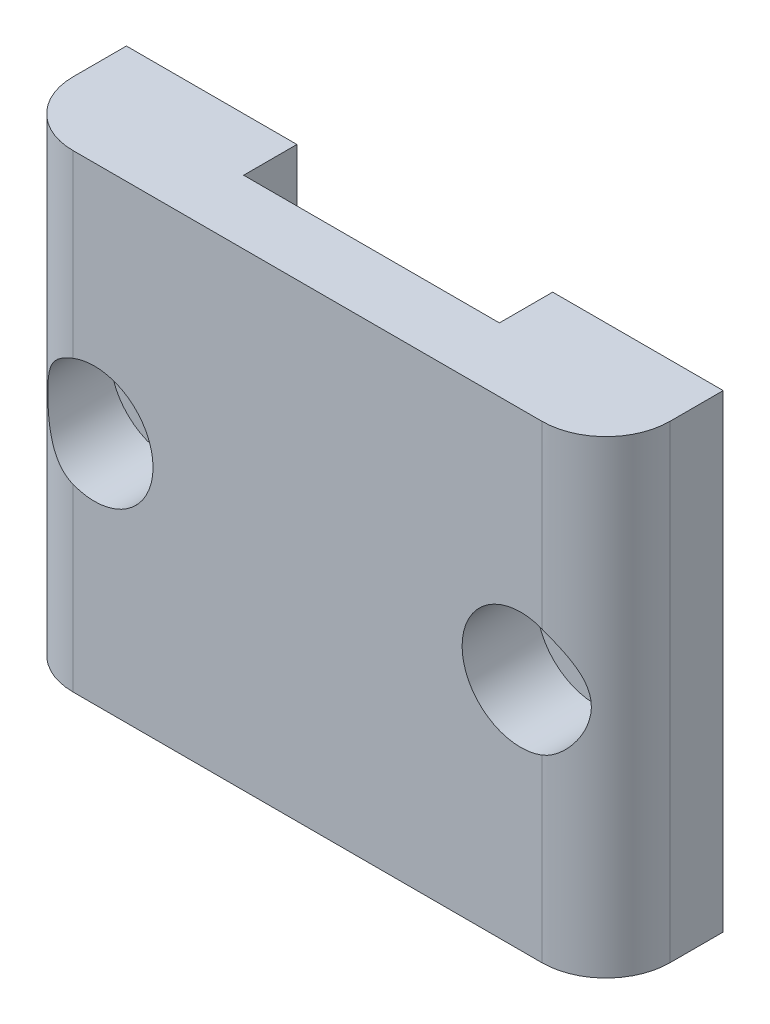
from build123d import *

# Parameters (mm, degrees)
SKETCH1_W           = 28
SKETCH1_H           = 22
BOSS_EXTRUDE1_DEPTH = 3
SKETCH2_W           = 8
SKETCH2_H           = 22
BOSS_EXTRUDE2_DEPTH = 2.5
SKETCH3_R           = 1.6
CUT_EXTRUDE1_DEPTH  = 19.634645154
SKETCH4_R           = 2.75
CUT_EXTRUDE2_DEPTH  = 3.5
FILLET1_R           = 3


with BuildPart() as part:
    # Sketch1 → Boss-Extrude1 (new body)
    with BuildSketch(Plane.XY):
        Rectangle(SKETCH1_W, SKETCH1_H)
    extrude(amount=-BOSS_EXTRUDE1_DEPTH)

    # Sketch2 → Boss-Extrude2 (add)
    with BuildSketch(Plane(origin=(0, 0, -3), x_dir=(-1, 0, 0), z_dir=(0, 0, -1))):
        with Locations((10, 0)):
            Rectangle(SKETCH2_W, SKETCH2_H)
        with Locations((-10, 0)):
            Rectangle(SKETCH2_W, SKETCH2_H)
    extrude(amount=BOSS_EXTRUDE2_DEPTH)

    # Sketch3 → Cut-Extrude1 (cut, through all)
    with BuildSketch(Plane(origin=(0, 0, -5.5), x_dir=(-1, 0, 0), z_dir=(0, 0, -1))):
        with Locations((-10, 0)):
            Circle(SKETCH3_R)
        with Locations(Location((10, 0, 0), (0, 0, 180))):
            Circle(SKETCH3_R)
    extrude(amount=-CUT_EXTRUDE1_DEPTH, mode=Mode.SUBTRACT)

    # Sketch4 → Cut-Extrude2 (cut)
    with BuildSketch(Plane.XY):
        with Locations((-10, 0)):
            Circle(SKETCH4_R)
        with Locations((10, 0)):
            Circle(SKETCH4_R)
    extrude(amount=-CUT_EXTRUDE2_DEPTH, mode=Mode.SUBTRACT)

    # Fillet1
    # the kernel refuses this fillet: 3 mm, written as the material it takes off along each edge
    with BuildSketch(Plane(origin=(14, 18.5, 0), x_dir=(0, 0, -1), z_dir=(0, -1, 0)), Plane(origin=(-14, -18.5, 0), x_dir=(0, 0, -1), z_dir=(0, 1, 0))) as fillet1_piece_1:
        with BuildLine():
            CenterArc((FILLET1_R, -FILLET1_R), FILLET1_R, 90, 90)
            Line((0, -FILLET1_R), (0, 0))
            Line((0, 0), (FILLET1_R, 0))
        make_face()
    extrude(amount=37, mode=Mode.SUBTRACT)


solid = part.part
